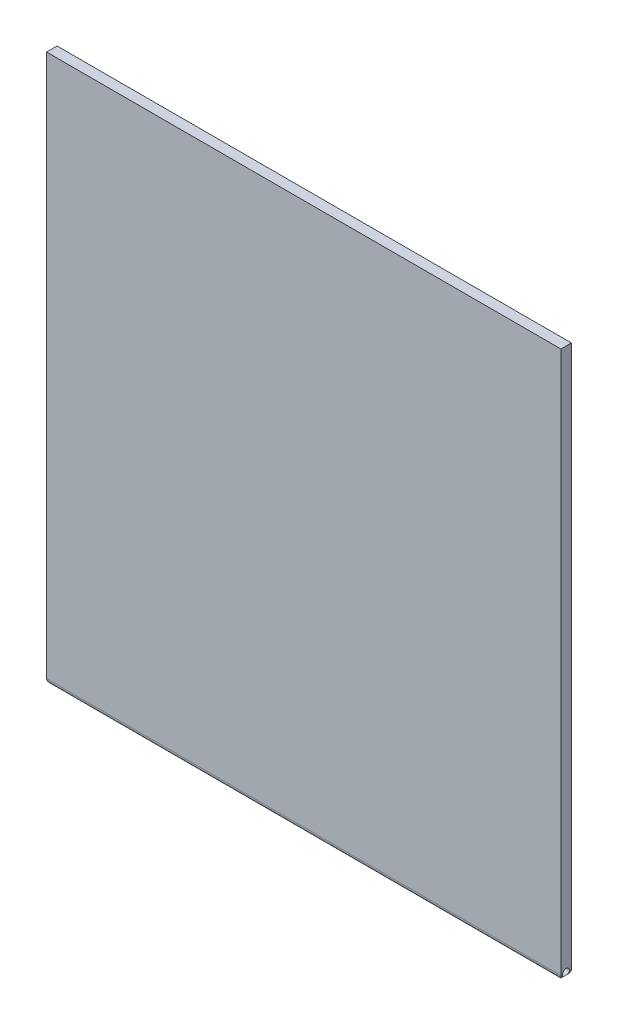
from build123d import *

# Parameters (mm, degrees)
SKETCH_1_W          = 147.3
SKETCH_1_H          = 156.9
EXTRUDE_1_DEPTH     = 3
SKETCH_2_R          = 1
CUT_EXTRUDE_1_DEPTH = 185.712864908
FILLET_1_R          = 1.5


with BuildPart() as part:
    # 草图1 → 凸台-拉伸1 (new body)
    with BuildSketch(Plane.XY):
        with Locations((-35.147833333, 32.96163522)):
            Rectangle(SKETCH_1_W, SKETCH_1_H)
    extrude(amount=EXTRUDE_1_DEPTH)

    # 草图2 → 切除-拉伸1 (cut, through all)
    with BuildSketch(Plane(origin=(38.502166667, 0, 0), x_dir=(0, 0, -1), z_dir=(1, 0, 0))):
        with Locations(Location((-1.5, -43.98836478, 0), (0, 0, 90))):
            Circle(SKETCH_2_R)
    extrude(amount=-CUT_EXTRUDE_1_DEPTH, mode=Mode.SUBTRACT)

    # 圆角1
    # the kernel refuses this fillet: 1.5 mm, written as the material it takes off along each edge
    with BuildSketch(Plane(origin=(42.252166667, -45.48836478, 3), x_dir=(0, 1, 0), z_dir=(-1, 0, 0))) as fillet_1_piece_1:
        with BuildLine():
            CenterArc((FILLET_1_R, FILLET_1_R), FILLET_1_R, 180, 90)
            Line((0, FILLET_1_R), (0, 0))
            Line((0, 0), (FILLET_1_R, 0))
        make_face()
    extrude(amount=154.8, mode=Mode.SUBTRACT)
    with BuildSketch(Plane(origin=(42.252166667, -45.48836478, 0), x_dir=(0, 1, 0), z_dir=(-1, 0, 0))) as fillet_1_piece_2:
        with BuildLine():
            CenterArc((FILLET_1_R, -FILLET_1_R), FILLET_1_R, 90, 90)
            Line((0, -FILLET_1_R), (0, 0))
            Line((0, 0), (FILLET_1_R, 0))
        make_face()
    extrude(amount=154.8, mode=Mode.SUBTRACT)
    with BuildSketch(Plane(origin=(38.502166667, -45.48836478, -3.75), x_dir=(0, 1, 0), z_dir=(0, 0, 1))) as fillet_1_piece_3:
        with BuildLine():
            CenterArc((FILLET_1_R, FILLET_1_R), FILLET_1_R, 180, 90)
            Line((0, FILLET_1_R), (0, 0))
            Line((0, 0), (FILLET_1_R, 0))
        make_face()
    extrude(amount=10.5, mode=Mode.SUBTRACT)
    with BuildSketch(Plane(origin=(-108.797833333, -45.48836478, -3.75), x_dir=(0, 1, 0), z_dir=(0, 0, 1))) as fillet_1_piece_4:
        with BuildLine():
            CenterArc((FILLET_1_R, -FILLET_1_R), FILLET_1_R, 90, 90)
            Line((0, -FILLET_1_R), (0, 0))
            Line((0, 0), (FILLET_1_R, 0))
        make_face()
    extrude(amount=10.5, mode=Mode.SUBTRACT)


solid = part.part
